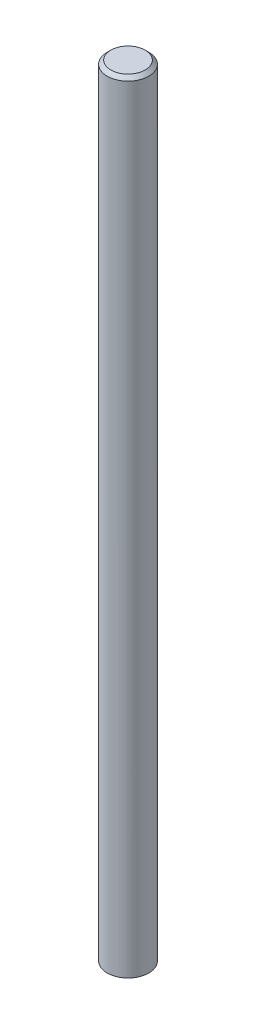
from build123d import *

# Parameters (mm, degrees)
SCHIZZO1_R                   = 4
ESTRUSIONE_ESTRUSIONE1_DEPTH = 150


# Read off the part's stored shape, not the designer's step: M8 Filettature a macchina Borchia1
with BuildPart() as part:
    # Schizzo1 → Estrusione-Estrusione1 (new body)
    with BuildSketch(Plane(origin=(0, 0, 0), x_dir=(1, 0, 0), z_dir=(0, 1, 0))):
        with Locations(Location((0, 0, 0), (0, 0, 270))):
            Circle(SCHIZZO1_R)
    extrude(amount=ESTRUSIONE_ESTRUSIONE1_DEPTH)

    # M8 Filettature a macchina Borchia1 outli → M8 Filettature a macchina Borchia1 (revolve, cut)
    with BuildSketch(Plane.XY):
        Polygon((4, 150), (3.3095, 150), (4, 149.3095), align=None)
    revolve(axis=Axis((0, 0, 0), (0, 1, 0)), mode=Mode.SUBTRACT)


solid = part.part
